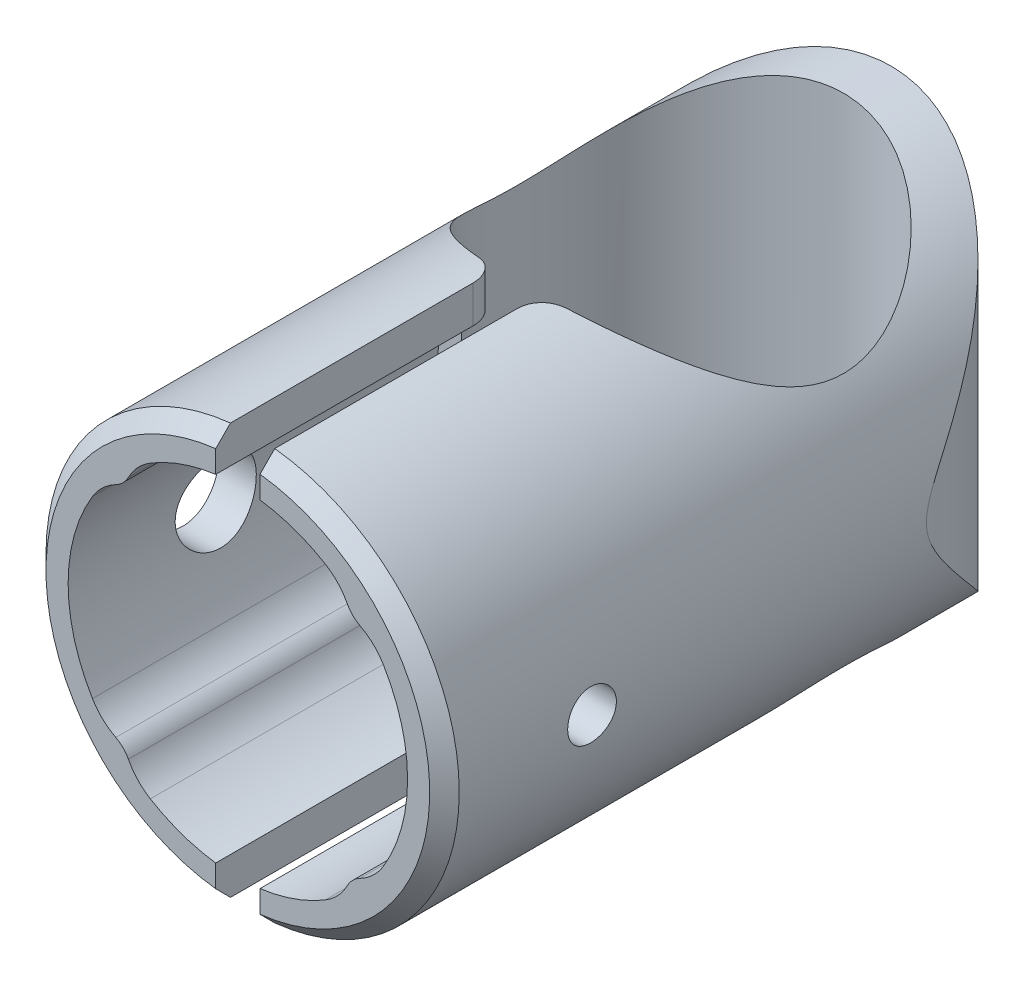
from build123d import *

# Parameters (mm, degrees)
SKETCH_1_R            = 14
EXTRUDE_1_DEPTH       = 45
CUT_EXTRUDE_1_DEPTH   = 55.817880295
CUT_EXTRUDE_2_DEPTH   = 55.817880455
CUT_EXTRUDE_3_DEPTH   = 25
HOLE_WIZARD_M51_D     = 5.5
HOLE_WIZARD_M51_DEPTH = 5
HOLE_WIZARD_M51_TIP   = 1.652366702
M4X0_71_D             = 3.3
M4X0_71_DEPTH         = 11.5
M4X0_71_TIP           = 0.991420021
CHAMFER_1_SIZE        = 1
FILLET_1_R            = 2


with BuildPart() as part:
    # Эскиз1 → Бобышка-Вытянуть1 (new body)
    with BuildSketch(Plane.XY):
        with Locations(Location((0, 0, 0), (0, 0, 180))):
            Circle(SKETCH_1_R)
    extrude(amount=EXTRUDE_1_DEPTH)

    # Эскиз2 → Вырез-Вытянуть1 (cut, through all)
    with BuildSketch(Plane(origin=(0, 14, 0), x_dir=(1, 0, 0), z_dir=(0, 1, 0))):
        with BuildLine():
            Line((-1.5, -25.947716657), (-1.5, -45))
            Line((-1.5, -45), (1.5, -45))
            Line((1.5, -45), (1.5, -25.947716657))
            ThreePointArc((1.5, -25.947716657), (0, -3.95), (-1.5, -25.947716657))
        make_face()
    extrude(amount=-CUT_EXTRUDE_1_DEPTH, mode=Mode.SUBTRACT)

    # Эскиз3 → Вырез-Вытянуть2 (cut, through all)
    with BuildSketch(Plane(origin=(0, 14, 0), x_dir=(1, 0, 0), z_dir=(0, 1, 0))):
        with BuildLine():
            Line((-14, 0), (14, 0))
            Line((14, 0), (14, -12.342463547))
            ThreePointArc((14, -12.342463547), (0, -0.75), (-14, -12.342463547))
            Line((-14, -12.342463547), (-14, 0))
        make_face()
    extrude(amount=-CUT_EXTRUDE_2_DEPTH, mode=Mode.SUBTRACT)

    # Эскиз5 → Вырез-Вытянуть3 (cut)
    with BuildSketch(Plane.XY.offset(45)):
        with BuildLine():
            ThreePointArc((-9.852095289, 5.931797233), (-11.5, 0), (-9.852095289, -5.931797233))
            ThreePointArc((-9.852095289, -5.931797233), (-9.163775239, -6.784149338), (-8.270018616, -7.417779908))
            ThreePointArc((-8.270018616, -7.417779908), (-7.778174593, -7.778174593), (-7.417779908, -8.270018616))
            ThreePointArc((-7.417779908, -8.270018616), (-6.784149338, -9.163775239), (-5.931797233, -9.852095289))
            ThreePointArc((-5.931797233, -9.852095289), (0, -11.5), (5.931797233, -9.852095289))
            ThreePointArc((5.931797233, -9.852095289), (6.784149338, -9.163775239), (7.417779908, -8.270018616))
            ThreePointArc((7.417779908, -8.270018616), (7.778174593, -7.778174593), (8.270018616, -7.417779908))
            ThreePointArc((8.270018616, -7.417779908), (9.163775239, -6.784149338), (9.852095289, -5.931797233))
            ThreePointArc((9.852095289, -5.931797233), (11.5, 0), (9.852095289, 5.931797233))
            ThreePointArc((9.852095289, 5.931797233), (9.163775239, 6.784149338), (8.270018616, 7.417779908))
            ThreePointArc((8.270018616, 7.417779908), (7.778174593, 7.778174593), (7.417779908, 8.270018616))
            ThreePointArc((7.417779908, 8.270018616), (6.784149338, 9.163775239), (5.931797233, 9.852095289))
            ThreePointArc((5.931797233, 9.852095289), (0, 11.5), (-5.931797233, 9.852095289))
            ThreePointArc((-5.931797233, 9.852095289), (-6.784149338, 9.163775239), (-7.417779908, 8.270018616))
            ThreePointArc((-7.417779908, 8.270018616), (-7.778174593, 7.778174593), (-8.270018616, 7.417779908))
            ThreePointArc((-8.270018616, 7.417779908), (-9.163775239, 6.784149338), (-9.852095289, 5.931797233))
        make_face()
    extrude(amount=-CUT_EXTRUDE_3_DEPTH, mode=Mode.SUBTRACT)

    # Отверстие с зазором M51
    with Locations(Plane.ZY.offset(14)):
        with Locations((35, 0)):
            Hole(HOLE_WIZARD_M51_D / 2, depth=HOLE_WIZARD_M51_DEPTH)
            with Locations((0, 0, -(HOLE_WIZARD_M51_DEPTH + HOLE_WIZARD_M51_TIP / 2))):  # 118° drill point
                Cone(0, HOLE_WIZARD_M51_D / 2, HOLE_WIZARD_M51_TIP, mode=Mode.SUBTRACT)

    # Отверстие обработанное метчиком M4x0.71
    with Locations(Plane(origin=(14, 0, 0), x_dir=(0, 0, -1), z_dir=(1, 0, 0))):
        with Locations((-35, 0)):
            Hole(M4X0_71_D / 2, depth=M4X0_71_DEPTH)
            with Locations((0, 0, -(M4X0_71_DEPTH + M4X0_71_TIP / 2))):  # 118° drill point
                Cone(0, M4X0_71_D / 2, M4X0_71_TIP, mode=Mode.SUBTRACT)

    # Фаска1
    chamfer_1_edges = [part.edges().sort_by_distance(p)[0] for p in [
        (-10.416333328, 9.354143467, 45),
        (14, 0, 45),
    ]]
    chamfer(chamfer_1_edges, length=CHAMFER_1_SIZE)

    # Скругление1
    # the kernel refuses this fillet: 2 mm, written as the material it takes off along each edge
    with BuildSketch(Plane(origin=(-1.5, -7.341312757, 25.947716657), x_dir=(0, 0, 1), z_dir=(0, -1, 0))) as fillet_1_piece_1:
        with BuildLine():
            CenterArc((1.624176597, 2), FILLET_1_R, 195.557138824, 74.442861176)
            ThreePointArc((-0.302550338, 1.463601533), (-0.126502254, 0.736921732), (0, 0))
            Line((0, 0), (1.624176597, 0))
        make_face()
    extrude(amount=10.638539644, mode=Mode.SUBTRACT)
    with BuildSketch(Plane(origin=(1.5, -7.341312757, 25.947716657), x_dir=(0, 0, 1), z_dir=(0, -1, 0)), Plane(origin=(1.5, 17.979852401, 25.947716657), x_dir=(0, 0, 1), z_dir=(0, -1, 0))) as fillet_1_piece_2:
        with BuildLine():
            CenterArc((1.624176597, -2), FILLET_1_R, 90, 74.442861176)
            ThreePointArc((-0.302550338, -1.463601533), (-0.126502254, -0.736921732), (0, 0))
            Line((0, 0), (1.624176597, 0))
        make_face()
    extrude(amount=10.638539644, mode=Mode.SUBTRACT)
    with BuildSketch(Plane(origin=(-1.5, 17.979852401, 25.947716657), x_dir=(-0.9792954211159031, 0, -0.2024363558786464), z_dir=(0, -1, 0))) as fillet_1_piece_3:
        with BuildLine():
            CenterArc((1.629798451, -1.995421417), FILLET_1_R, 93.877672052, 74.442861176)
            Line((-0.328792392, -1.590548705), (0, 0))
            ThreePointArc((0, 0), (0.747272734, -0.025296672), (1.494545467, 0))
        make_face()
    extrude(amount=10.638539644, mode=Mode.SUBTRACT)


solid = part.part
